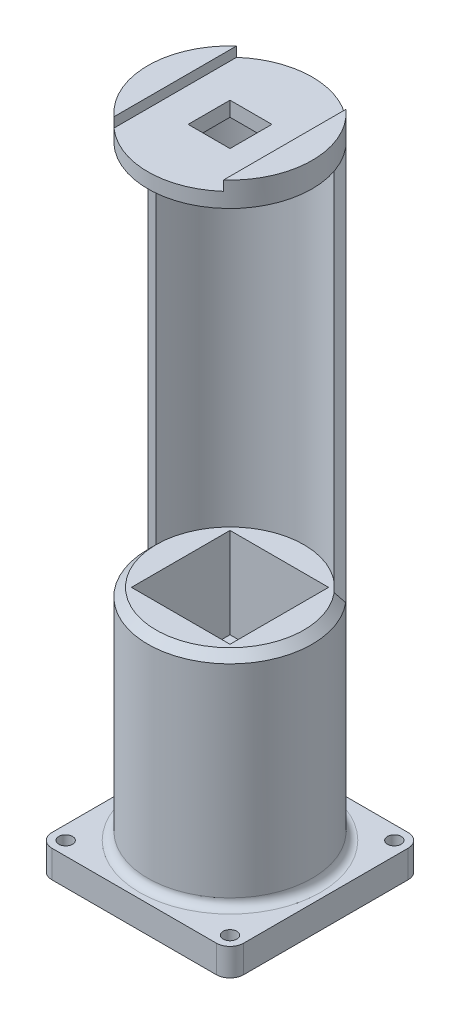
from build123d import *

# Parameters (mm, degrees)
SKETCH1_W                = 350
SKETCH1_H                = 350
BOSS_EXTRUDE1_DEPTH      = 50
FILLET1_R                = 25
SKETCH2_R                = 12.5
CUT_EXTRUDE1_DEPTH       = 50
SKETCH3_R                = 150
BOSS_EXTRUDE2_DEPTH      = 400
FILLET2_R                = 15
CHAMFER1_SIZE            = 15
SKETCH5_W                = 180
SKETCH5_H                = 180
CUT_EXTRUDE3_DEPTH       = 165
SCALE1_SCALE             = 0.333333333
EXTRUDE_THIN1_DEPTH      = 250
EXTRUDE_THIN1_DEPTH_BACK = 5
BOSS_EXTRUDE3_START      = -15
SKETCH7_R                = 50
BOSS_EXTRUDE3_DEPTH      = 15
SKETCH8_W                = 25.5
SKETCH8_H                = 25.5
CUT_EXTRUDE4_DEPTH       = 9.5
SKETCH9_W                = 66.666666667
SKETCH9_H                = 100
CUT_EXTRUDE5_DEPTH       = 6


with BuildPart() as part:
    # Sketch1 → Boss-Extrude1 (new body)
    with BuildSketch(Plane(origin=(0, 0, 0), x_dir=(1, 0, 0), z_dir=(0, 1, 0))):
        with Locations((175, 175)):
            Rectangle(SKETCH1_W, SKETCH1_H)
    extrude(amount=-BOSS_EXTRUDE1_DEPTH)

    # Fillet1
    fillet1_edges = [part.edges().sort_by_distance(p)[0] for p in [
        (0, -25, -350),
        (350, -25, -350),
        (350, -25, 0),
        (0, -25, 0),
    ]]
    fillet(fillet1_edges, radius=FILLET1_R)

    # Sketch2 → Cut-Extrude1 (cut)
    with BuildSketch(Plane(origin=(0, 0, 0), x_dir=(1, 0, 0), z_dir=(0, 1, 0))):
        with Locations((25, 25)):
            Circle(SKETCH2_R)
        with Locations((325, 25)):
            Circle(SKETCH2_R)
        with Locations((325, 325)):
            Circle(SKETCH2_R)
        with Locations((25, 325)):
            Circle(SKETCH2_R)
    extrude(amount=-CUT_EXTRUDE1_DEPTH, mode=Mode.SUBTRACT)

    # Sketch3 → Boss-Extrude2 (add)
    with BuildSketch(Plane(origin=(0, 0, 0), x_dir=(1, 0, 0), z_dir=(0, 1, 0))):
        with Locations((175, 175)):
            Circle(SKETCH3_R)
    extrude(amount=BOSS_EXTRUDE2_DEPTH)

    # Fillet2
    fillet2_edges = [part.edges().sort_by_distance(p)[0] for p in [
        (25, 0, -175),
    ]]
    fillet(fillet2_edges, radius=FILLET2_R)

    # Chamfer1
    chamfer1_edges = [part.edges().sort_by_distance(p)[0] for p in [
        (25, 400, -175),
    ]]
    chamfer(chamfer1_edges, length=CHAMFER1_SIZE)

    # Sketch5 → Cut-Extrude3 (cut)
    with BuildSketch(Plane.XZ.offset(-400)):
        with Locations((175, -175)):
            Rectangle(SKETCH5_W, SKETCH5_H)
    extrude(amount=CUT_EXTRUDE3_DEPTH, mode=Mode.SUBTRACT)


with BuildPart() as part_1:
    # Scale1: scaled about (0, 0, 0)
    add(part.part.scale(SCALE1_SCALE))

    # Sketch6 → Extrude-Thin1 (add, two sides: drawn at the far end of the back side and taken through both)
    with BuildSketch(Plane(origin=(0, 133.333333333, 0), x_dir=(1, 0, 0), z_dir=(0, 1, 0)).offset(-EXTRUDE_THIN1_DEPTH_BACK)):
        with BuildLine():
            ThreePointArc((8.333333333, 58.333333333), (41.232326167, 105.317964373), (96.635555489, 90.472713818))
            Line((96.635555489, 90.472713818), (92.805333274, 87.258775769))
            ThreePointArc((92.805333274, 87.258775769), (42.942426884, 100.619501269), (13.333333333, 58.333333333))
            Line((13.333333333, 58.333333333), (8.333333333, 58.333333333))
        make_face()
    extrude(amount=EXTRUDE_THIN1_DEPTH + EXTRUDE_THIN1_DEPTH_BACK)

    # Sketch7 → Boss-Extrude3 (add)
    with BuildSketch(Plane(origin=(0, 383.333333333, 0), x_dir=(1, 0, 0), z_dir=(0, 1, 0)).offset(BOSS_EXTRUDE3_START)):
        with Locations((58.333333333, 58.333333333)):
            Circle(SKETCH7_R)
    extrude(amount=BOSS_EXTRUDE3_DEPTH)

    # Sketch8 → Cut-Extrude4 (cut)
    with BuildSketch(Plane.XZ.offset(-368.333333333)):
        with Locations((58.333333333, -58.333333333)):
            Rectangle(SKETCH8_W, SKETCH8_H)
    extrude(amount=-CUT_EXTRUDE4_DEPTH, mode=Mode.SUBTRACT)

    # Sketch9 → Cut-Extrude5 (cut)
    with BuildSketch(Plane(origin=(0, 383.333333333, 0), x_dir=(1, 0, 0), z_dir=(0, 1, 0))):
        with Locations((58.333333334, 58.333333333)):
            Rectangle(SKETCH9_W, SKETCH9_H)
    extrude(amount=-CUT_EXTRUDE5_DEPTH, mode=Mode.SUBTRACT)


solid = part_1.part
